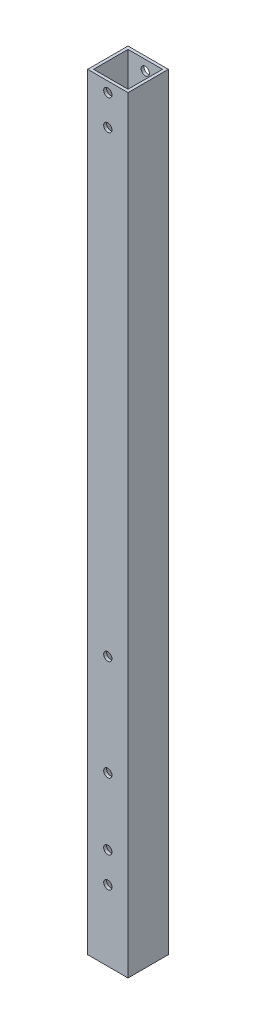
from build123d import *

# Parameters (mm, degrees)
SKETCH1_W           = 20
SKETCH1_H           = 20
SKETCH1_W_2         = 17.1
SKETCH1_H_2         = 17.1
BOSS_EXTRUDE1_DEPTH = 350
SKETCH2_R           = 2.05
CUT_EXTRUDE1_DEPTH  = 352.140997322
SKETCH3_R           = 2.05
CUT_EXTRUDE2_DEPTH  = 352.140997322
SKETCH4_W           = 20
SKETCH4_H           = 20
SKETCH4_W_2         = 17.1
SKETCH4_H_2         = 17.1
BOSS_EXTRUDE2_DEPTH = 30


with BuildPart() as part:
    # Sketch1 → Boss-Extrude1 (new body)
    with BuildSketch(Plane(origin=(0, 0, 0), x_dir=(1, 0, 0), z_dir=(0, 1, 0))):
        with Locations((10, 10)):
            Rectangle(SKETCH1_W, SKETCH1_H)
        with Locations((10, 10)):
            Rectangle(SKETCH1_W_2, SKETCH1_H_2, mode=Mode.SUBTRACT)
    extrude(amount=BOSS_EXTRUDE1_DEPTH)

    # Sketch2 → Cut-Extrude1 (cut, through all)
    with BuildSketch(Plane(origin=(0, 0, -20), x_dir=(-1, 0, 0), z_dir=(0, 0, -1))):
        with Locations((-10, 345)):
            Circle(SKETCH2_R)
        with Locations((-10, 330)):
            Circle(SKETCH2_R)
        with Locations((-10, 20)):
            Circle(SKETCH2_R)
        with Locations((-10, 5)):
            Circle(SKETCH2_R)
    extrude(amount=-CUT_EXTRUDE1_DEPTH, mode=Mode.SUBTRACT)

    # Sketch3 → Cut-Extrude2 (cut, through all)
    with BuildSketch(Plane(origin=(0, 0, -20), x_dir=(-1, 0, 0), z_dir=(0, 0, -1))):
        with Locations((-10, 103)):
            Circle(SKETCH3_R)
        with Locations((-10, 53)):
            Circle(SKETCH3_R)
    extrude(amount=-CUT_EXTRUDE2_DEPTH, mode=Mode.SUBTRACT)

    # Sketch4 → Boss-Extrude2 (add)
    with BuildSketch(Plane.XZ):
        with Locations((10, -10)):
            Rectangle(SKETCH4_W, SKETCH4_H)
        with Locations((10, -10)):
            Rectangle(SKETCH4_W_2, SKETCH4_H_2, mode=Mode.SUBTRACT)
    extrude(amount=BOSS_EXTRUDE2_DEPTH)


solid = part.part
